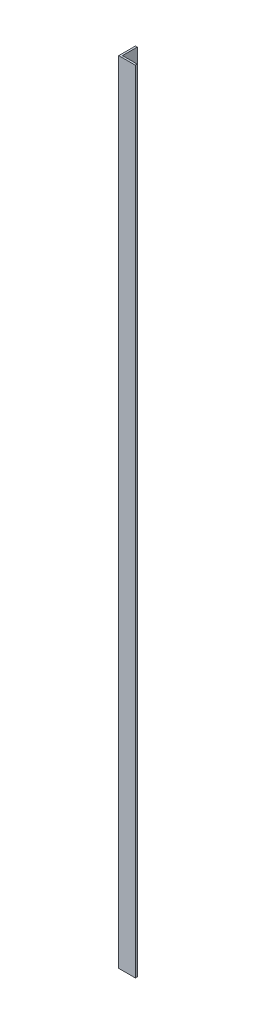
from build123d import *

# Parameters (mm, degrees)
BOSS_EXTRUDE1_DEPTH = 904.4


with BuildPart() as part:
    # Sketch1 → Boss-Extrude1 (new body)
    with BuildSketch(Plane(origin=(0, 0, 0), x_dir=(1, 0, 0), z_dir=(0, 1, 0))):
        Polygon((0, 0), (0, -19.05), (19.05, -19.05), (19.05, -16.9), (2.15, -16.9), (2.15, 0), align=None)
    extrude(amount=BOSS_EXTRUDE1_DEPTH)


solid = part.part
